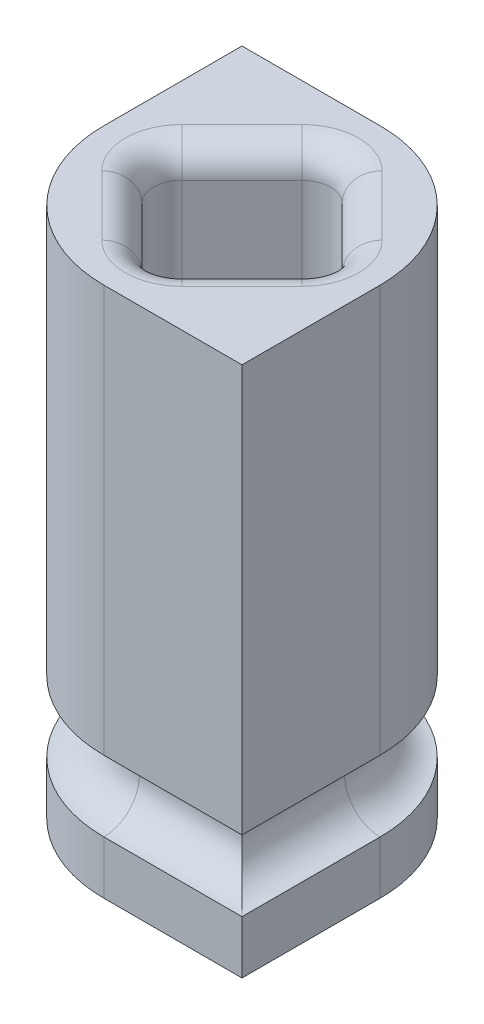
from build123d import *

# Parameters (mm, degrees)
BOSS_EXTRUDE1_DEPTH     = 5
CUT_EXTRUDE2_DEPTH      = 1
CUT_EXTRUDE2_DEPTH_BACK = 1
FILLET1_R               = 1
BOSS_EXTRUDE3_DEPTH     = 10
FILLET2_R               = 0.8


with BuildPart() as part:
    # Sketch1 → Boss-Extrude1 (new body)
    with BuildSketch(Plane(origin=(0, 0, 0), x_dir=(1, 0, 0), z_dir=(0, 1, 0))):
        with BuildLine():
            Line((-3.9, 3.9), (0, 3.9))
            ThreePointArc((0, 3.9), (2.757716447, 2.757716447), (3.9, 0))
            Line((3.9, 0), (3.9, -3.9))
            Line((3.9, -3.9), (0, -3.9))
            ThreePointArc((0, -3.9), (-2.757716447, -2.757716447), (-3.9, 0))
            Line((-3.9, 0), (-3.9, 3.9))
        make_face()
    extrude(amount=BOSS_EXTRUDE1_DEPTH)

    # Sketch3 → Cut-Extrude2 (cut, two sides: drawn at the far end of the back side and taken through both)
    with BuildSketch(Plane(origin=(0, 2.5, 0), x_dir=(1, 0, 0), z_dir=(0, 1, 0)).offset(-CUT_EXTRUDE2_DEPTH_BACK)):
        with BuildLine():
            Line((-3.9, 0), (-3.9, 3.9))
            Line((-3.9, 3.9), (0, 3.9))
            ThreePointArc((0, 3.9), (2.757716447, 2.757716447), (3.9, 0))
            Line((3.9, 0), (3.9, -3.9))
            Line((3.9, -3.9), (0, -3.9))
            ThreePointArc((0, -3.9), (-2.757716447, -2.757716447), (-3.9, 0))
        make_face()
        with BuildLine():
            Line((-2.9, 0), (-2.9, 2.9))
            Line((-2.9, 2.9), (0, 2.9))
            ThreePointArc((0, 2.9), (2.050609665, 2.050609665), (2.9, 0))
            Line((2.9, 0), (2.9, -2.9))
            Line((2.9, -2.9), (0, -2.9))
            ThreePointArc((0, -2.9), (-2.050609665, -2.050609665), (-2.9, 0))
        make_face(mode=Mode.SUBTRACT)
    extrude(amount=CUT_EXTRUDE2_DEPTH + CUT_EXTRUDE2_DEPTH_BACK, mode=Mode.SUBTRACT)

    # Fillet1
    fillet1_edges = [part.edges().sort_by_distance(p)[0] for p in [
        (2.9, 3.5, 1.45),
        (2.050609665, 3.5, -2.050609665),
        (1.45, 3.5, 2.9),
        (-2.050609665, 3.5, 2.050609665),
        (2.9, 1.5, 1.45),
        (2.050609665, 1.5, -2.050609665),
        (-2.9, 1.5, -1.45),
        (1.45, 1.5, 2.9),
        (-1.45, 3.5, -2.9),
        (-2.9, 3.5, -1.45),
        (-1.45, 1.5, -2.9),
        (-2.050609665, 1.5, 2.050609665),
    ]]
    fillet(fillet1_edges, radius=FILLET1_R - 0.0001)  # a hair under: the kernel refuses the full size

    # Sketch4 → Boss-Extrude3 (add)
    with BuildSketch(Plane(origin=(0, 5, 0), x_dir=(1, 0, 0), z_dir=(0, 1, 0))):
        with BuildLine():
            Line((0, 3.9), (-3.9, 3.9))
            Line((-3.9, 3.9), (-3.9, 0))
            ThreePointArc((-3.9, 0), (-2.757716447, -2.757716447), (0, -3.9))
            Line((0, -3.9), (3.9, -3.9))
            Line((3.9, -3.9), (3.9, 0))
            ThreePointArc((3.9, 0), (2.757716447, 2.757716447), (0, 3.9))
        make_face()
        with BuildLine():
            Line((-2.2627417, -0.565685425), (-0.565685425, -2.2627417))
            ThreePointArc((-0.565685425, -2.2627417), (0, -2.497056275), (0.565685425, -2.2627417))
            Line((0.565685425, -2.2627417), (2.2627417, -0.565685425))
            ThreePointArc((2.2627417, -0.565685425), (2.497056275, 0), (2.2627417, 0.565685425))
            Line((2.2627417, 0.565685425), (0.565685425, 2.2627417))
            ThreePointArc((0.565685425, 2.2627417), (0, 2.497056275), (-0.565685425, 2.2627417))
            Line((-0.565685425, 2.2627417), (-2.2627417, 0.565685425))
            ThreePointArc((-2.2627417, 0.565685425), (-2.497056275, 0), (-2.2627417, -0.565685425))
        make_face(mode=Mode.SUBTRACT)
    extrude(amount=BOSS_EXTRUDE3_DEPTH)

    # Fillet2
    fillet2_edges = [part.edges().sort_by_distance(p)[0] for p in [
        (0, 15, 2.497056275),
        (1.414213562, 15, 1.414213562),
        (2.497056275, 15, 0),
        (1.414213562, 15, -1.414213562),
        (0, 15, -2.497056275),
        (-1.414213562, 15, -1.414213562),
        (-2.497056275, 15, 0),
        (-1.414213562, 15, 1.414213562),
    ]]
    fillet(fillet2_edges, radius=FILLET2_R)


solid = part.part
